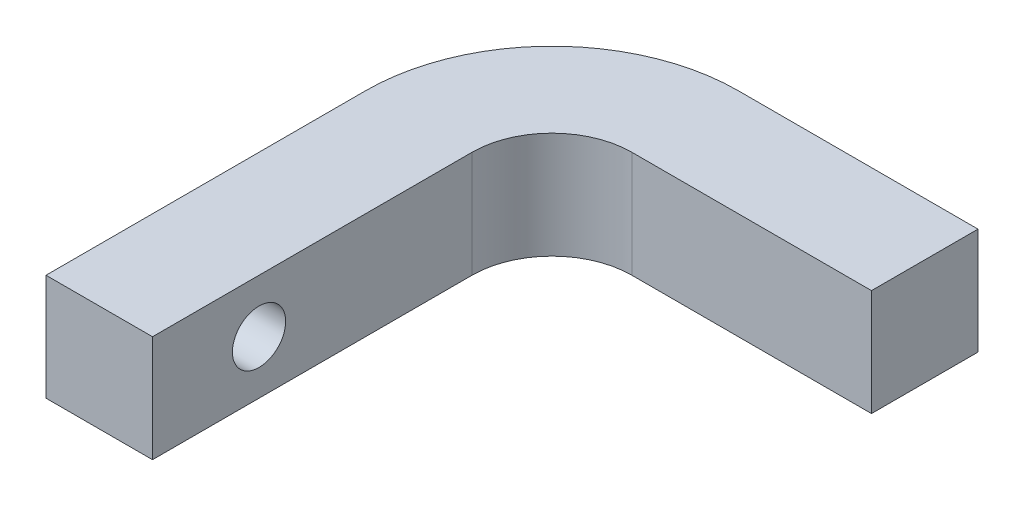
from build123d import *

# Parameters (mm, degrees)
BOSS_EXTRUDE1_DEPTH      = 4
BOSS_EXTRUDE1_DEPTH_BACK = 4
CUT_EXTRUDE1_DEPTH       = 46.122056691
CUT_EXTRUDE1_DEPTH_BACK  = 46.122056691
SKETCH2_R                = 2


with BuildPart() as part:
    # Sketch1 → Boss-Extrude1 (new, two sides: drawn at the far end of the back side and taken through both)
    with BuildSketch(Plane(origin=(0, 0, 0), x_dir=(1, 0, 0), z_dir=(0, 1, 0)).offset(-BOSS_EXTRUDE1_DEPTH_BACK)):
        with BuildLine():
            Line((-9, 0), (9, 0))
            Line((9, 0), (9, -8))
            Line((9, -8), (-9, -8))
            ThreePointArc((-9, -8), (-13.242640687, -9.757359313), (-15, -14))
            Line((-15, -14), (-15, -38))
            Line((-15, -38), (-23, -38))
            Line((-23, -38), (-23, -14))
            ThreePointArc((-23, -14), (-18.899494937, -4.100505063), (-9, 0))
        make_face()
    extrude(amount=BOSS_EXTRUDE1_DEPTH + BOSS_EXTRUDE1_DEPTH_BACK)

    # Sketch2 → Cut-Extrude1 (cut, two sides: drawn at the far end of the back side and taken through both)
    with BuildSketch(Plane.ZY.offset(15).offset(-CUT_EXTRUDE1_DEPTH_BACK)):
        with Locations((30, 0)):
            Circle(SKETCH2_R)
    extrude(amount=CUT_EXTRUDE1_DEPTH + CUT_EXTRUDE1_DEPTH_BACK, mode=Mode.SUBTRACT)


solid = part.part
